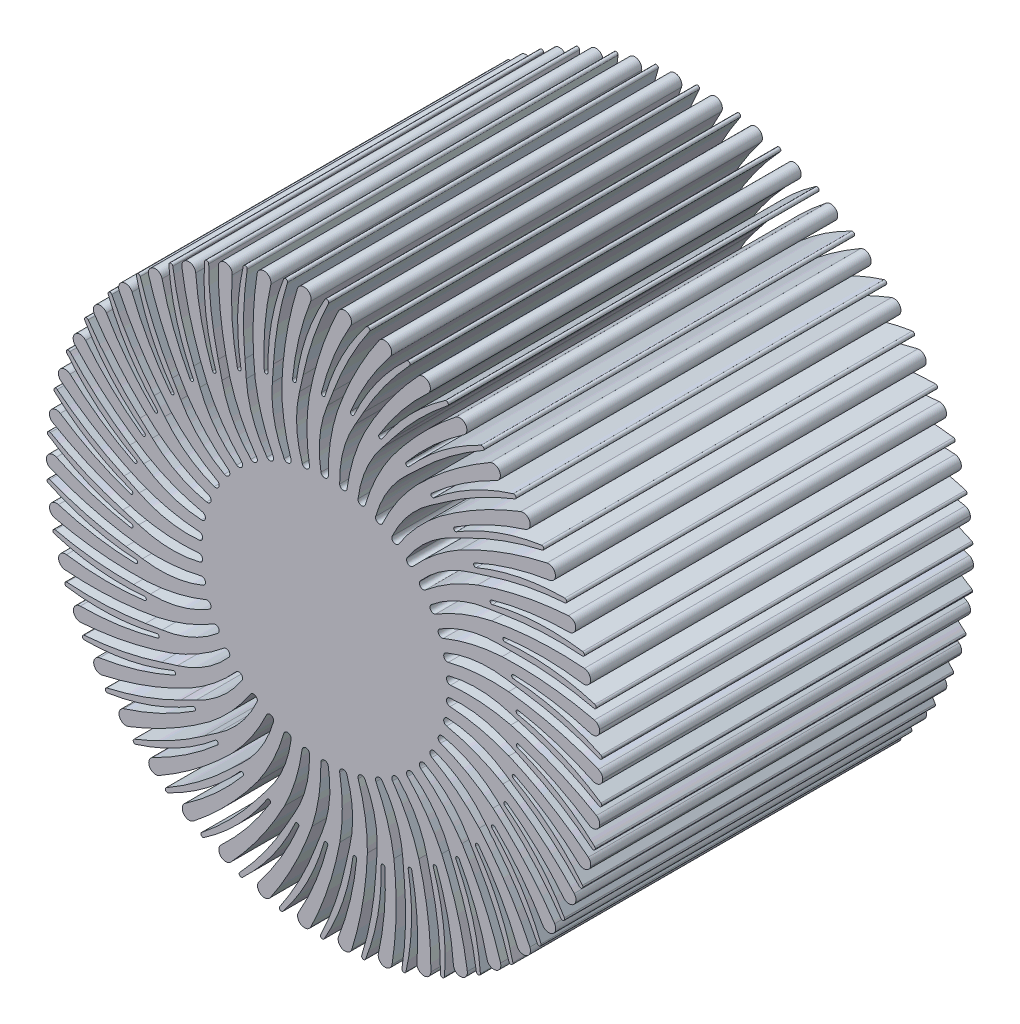
from build123d import *

# Parameters (mm, degrees)
IZIM1_R                     = 30
Y_KSEKLIK_EKSTR_ZYON1_DEPTH = 40
KES_EKSTR_ZYON3_DEPTH       = 40
DAIRESEL_KAPLAMA1_COUNT     = 42
RADYUS1_R                   = 0.65
RADYUS2_R                   = 0.2
KES_EKSTR_ZYON4_DEPTH       = 80
DAIRESEL_KAPLAMA7_COUNT     = 42


with BuildPart() as part:
    # Çizim1 → Yükseklik-Ekstrüzyon1 (new body)
    with BuildSketch(Plane.XY):
        Circle(IZIM1_R)
    extrude(amount=Y_KSEKLIK_EKSTR_ZYON1_DEPTH)

    # Çizim3 → Kes-Ekstrüzyon3 (cut)
    with BuildSketch(Plane.XY):
        with BuildLine():
            ThreePointArc((-11.479111904, 18.504971539), (-11.268971912, 17.629957216), (-11.070097909, 16.752313774))
            ThreePointArc((-11.070097909, 16.752313774), (-9.911572558, 13.632228953), (-7.940604818, 10.950364592))
            ThreePointArc((-7.940604818, 10.950364592), (-7.398315261, 10.922249187), (-7.327697377, 11.460655683))
            ThreePointArc((-7.327697377, 11.460655683), (-8.991462324, 14.27541609), (-10.174360914, 17.323651789))
            ThreePointArc((-10.174360914, 17.323651789), (-11.183221504, 22.478676942), (-11.461867112, 27.724097863))
            ThreePointArc((-11.461867112, 27.724097863), (-11.982049105, 27.503281609), (-12.497979479, 27.2727063))
            ThreePointArc((-12.497979479, 27.2727063), (-12.266047764, 22.856591381), (-11.479111904, 18.504971539))
        make_face()
        with BuildLine():
            ThreePointArc((-12.097598697, 17.144420074), (-11.843786054, 17.024637974), (-11.720111363, 17.276576817))
            ThreePointArc((-11.720111363, 17.276576817), (-12.812110447, 22.113901521), (-12.927815619, 27.071601048))
            ThreePointArc((-12.927815619, 27.071601048), (-13.453042253, 26.814467254), (-13.973157018, 26.547144535))
            ThreePointArc((-13.973157018, 26.547144535), (-13.401097511, 21.772832327), (-12.097598697, 17.144420074))
        make_face()
    kes_ekstr_zyon3 = extrude(amount=KES_EKSTR_ZYON3_DEPTH, mode=Mode.SUBTRACT)

    # Dairesel Kaplama1: Kes-Ekstrüzyon3 ×42 about axis
    dairesel_kaplama1_axis = Axis((0, 0, 0), (0, 0, 1))
    for i in range(1, DAIRESEL_KAPLAMA1_COUNT):
        add(kes_ekstr_zyon3.rotate(dairesel_kaplama1_axis, i * 360 / DAIRESEL_KAPLAMA1_COUNT), mode=Mode.SUBTRACT)

    # Radyus1
    radyus1_edges = [part.edges().sort_by_distance(p)[0] for p in [
        (26.499703129, -14.062920539, 20),
        (27.259318687, -12.527152299, 20),
    ]]
    fillet(radyus1_edges, radius=RADYUS1_R)

    # Radyus2
    radyus2_edges = [part.edges().sort_by_distance(p)[0] for p in [
        (27.711818562, -11.491523484, 20),
        (27.890124439, -11.051740079, 20),
    ]]
    fillet(radyus2_edges, radius=RADYUS2_R)

    # Çizim4 → Kes-Ekstrüzyon4 (cut)
    with BuildSketch(Plane.XY.offset(40)):
        with BuildLine():
            Line((-11.467070059, 27.217223533), (-11.775491501, 28.09324387))
            Line((-11.775491501, 28.09324387), (-9.292082524, 28.686502681))
            Line((-9.292082524, 28.686502681), (-9.964977366, 27.161957614))
            ThreePointArc((-9.964977366, 27.161957614), (-10.687455755, 27.966049585), (-11.467070059, 27.217223533))
        make_face()
        with BuildLine():
            Line((-12.937203139, 26.944025571), (-13.287710623, 27.402028879))
            Line((-13.287710623, 27.402028879), (-12.063122712, 27.612954653))
            Line((-12.063122712, 27.612954653), (-12.499985652, 26.928322995))
            ThreePointArc((-12.499985652, 26.928322995), (-12.711013157, 27.147263852), (-12.937203139, 26.944025571))
        make_face()
    kes_ekstr_zyon4 = extrude(amount=-KES_EKSTR_ZYON4_DEPTH, mode=Mode.SUBTRACT)

    # Dairesel Kaplama7: Kes-Ekstrüzyon4 ×42 about axis
    dairesel_kaplama7_axis = Axis((-0.002132768, -0.003969036, 0), (0, 0, 1))
    for i in range(1, DAIRESEL_KAPLAMA7_COUNT):
        add(kes_ekstr_zyon4.rotate(dairesel_kaplama7_axis, i * 360 / DAIRESEL_KAPLAMA7_COUNT), mode=Mode.SUBTRACT)


solid = part.part
